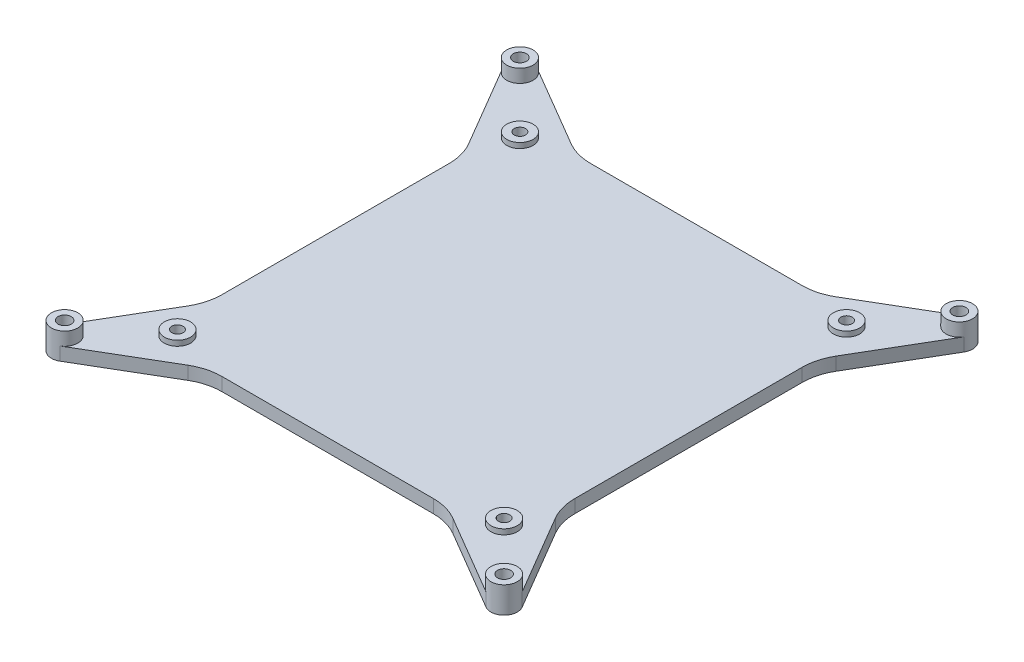
from build123d import *

# Parameters (mm, degrees)
SKETCH1_W                                  = 134
SKETCH1_H                                  = 140
BOSS_EXTRUDE1_DEPTH                        = 5
BOSS_EXTRUDE3_DEPTH                        = 5
SKETCH3_R                                  = 5
BOSS_EXTRUDE4_DEPTH                        = 5
HOLE1_OUTLINE_R                            = 2.5
HOLE1_DEPTH                                = 10
SKETCH6_R                                  = 5
BOSS_EXTRUDE5_DEPTH                        = 2
HOLE2_OUTLINE_R                            = 2.15
HOLE2_DEPTH                                = 7
MIRROR1_AT_THE_SECOND_PLANE_COPY_1_DEPTH   = 5
MIRROR1_AT_THE_SECOND_PLANE_COPY_2_SKETC_R = 5
MIRROR1_AT_THE_SECOND_PLANE_COPY_2_DEPTH   = 5
MIRROR1_AT_THE_SECOND_PLANE_COPY_3_SKETC_R = 2.5
MIRROR1_AT_THE_SECOND_PLANE_COPY_3_DEPTH   = 10
MIRROR1_AT_THE_SECOND_PLANE_COPY_4_SKETC_R = 5
MIRROR1_AT_THE_SECOND_PLANE_COPY_4_DEPTH   = 2
MIRROR1_AT_THE_SECOND_PLANE_COPY_5_SKETC_R = 2.15
MIRROR1_AT_THE_SECOND_PLANE_COPY_5_DEPTH   = 7
CUT_EXTRUDE_THIN1_DEPTH                    = 232.199441913
MIRROR2_AT_THE_SECOND_PLANE_COPY_1_DEPTH   = 232.199441913
FILLET1_R                                  = 20


# Read off the part's stored shape, not the designer's step: Hole1, Hole2
with BuildPart() as part:
    # Sketch1 → Boss-Extrude1 (new body)
    with BuildSketch(Plane(origin=(0, 0, 0), x_dir=(1, 0, 0), z_dir=(0, 1, 0))):
        with Locations((67, 70)):
            Rectangle(SKETCH1_W, SKETCH1_H)
    extrude(amount=BOSS_EXTRUDE1_DEPTH)

    # Sketch2 → Boss-Extrude3 (add)
    with BuildSketch(Plane(origin=(0, 5, 0), x_dir=(1, 0, 0), z_dir=(0, 1, 0))):
        with BuildLine():
            Line((0, 118.595175856), (-24.35045716, 150.329309467))
            ThreePointArc((-24.35045716, 150.329309467), (-23.487991569, 163.487991569), (-10.329309467, 164.35045716))
            Line((-10.329309467, 164.35045716), (21.404824144, 140))
            Line((21.404824144, 140), (0, 140))
            Line((0, 140), (0, 118.595175856))
        make_face()
    boss_extrude3 = extrude(amount=-BOSS_EXTRUDE3_DEPTH)

    # Sketch3 → Boss-Extrude4 (add)
    with BuildSketch(Plane(origin=(0, 5, 0), x_dir=(1, 0, 0), z_dir=(0, 1, 0))):
        with Locations(Location((-16.416923757, 156.416923757, 0), (0, 0, 90))):
            Circle(SKETCH3_R)
    boss_extrude4 = extrude(amount=BOSS_EXTRUDE4_DEPTH)

    # Hole1 outline → Hole1 (cut)
    with BuildSketch(Plane(origin=(0, 0, 0), x_dir=(1, 0, 0), z_dir=(0, 1, 0))):
        with Locations((-16.416923757, 156.416923757)):
            Circle(HOLE1_OUTLINE_R)
    hole1 = extrude(amount=HOLE1_DEPTH, mode=Mode.SUBTRACT)

    # Sketch6 → Boss-Extrude5 (add)
    with BuildSketch(Plane(origin=(0, 5, 0), x_dir=(1, 0, 0), z_dir=(0, 1, 0))):
        with Locations(Location((5, 135, 0), (0, 0, 90))):
            Circle(SKETCH6_R)
    boss_extrude5 = extrude(amount=BOSS_EXTRUDE5_DEPTH)

    # Hole2 outline → Hole2 (cut)
    with BuildSketch(Plane(origin=(0, 0, 0), x_dir=(1, 0, 0), z_dir=(0, 1, 0))):
        with Locations((5, 135)):
            Circle(HOLE2_OUTLINE_R)
    hole2 = extrude(amount=HOLE2_DEPTH, mode=Mode.SUBTRACT)

    # Mirror1: Boss-Extrude3, Boss-Extrude4, Hole1, Boss-Extrude5, Hole2 across plane
    add(boss_extrude3.mirror(Plane.XY.offset(-70)))
    add(boss_extrude4.mirror(Plane.XY.offset(-70)))
    add(hole1.mirror(Plane.XY.offset(-70)), mode=Mode.SUBTRACT)
    add(boss_extrude5.mirror(Plane.XY.offset(-70)))
    add(hole2.mirror(Plane.XY.offset(-70)), mode=Mode.SUBTRACT)

    # Mirror1 at the second plane: Boss-Extrude3, Boss-Extrude4, Hole1, Boss-Extrude5, Hole2 across plane
    add(boss_extrude3.mirror(Plane.ZY.offset(-67)))
    add(boss_extrude4.mirror(Plane.ZY.offset(-67)))
    add(hole1.mirror(Plane.ZY.offset(-67)), mode=Mode.SUBTRACT)
    add(boss_extrude5.mirror(Plane.ZY.offset(-67)))
    add(hole2.mirror(Plane.ZY.offset(-67)), mode=Mode.SUBTRACT)

    # Mirror1 at the second plane copy 1 sketc → Mirror1 at the second plane copy 1 (add)
    with BuildSketch(Plane(origin=(134, 5, -140), x_dir=(-1, 0, 0), z_dir=(0, 1, 0))):
        with BuildLine():
            Line((0, 118.595175856), (-24.35045716, 150.329309467))
            ThreePointArc((-24.35045716, 150.329309467), (-23.487991569, 163.487991569), (-10.329309467, 164.35045716))
            Line((-10.329309467, 164.35045716), (21.404824144, 140))
            Line((21.404824144, 140), (0, 140))
            Line((0, 140), (0, 118.595175856))
        make_face()
    extrude(amount=-MIRROR1_AT_THE_SECOND_PLANE_COPY_1_DEPTH)

    # Mirror1 at the second plane copy 2 sketc → Mirror1 at the second plane copy 2 (add)
    with BuildSketch(Plane(origin=(134, 5, -140), x_dir=(-1, 0, 0), z_dir=(0, 1, 0))):
        with Locations(Location((-16.416923757, 156.416923757, 0), (0, 0, 90))):
            Circle(MIRROR1_AT_THE_SECOND_PLANE_COPY_2_SKETC_R)
    extrude(amount=MIRROR1_AT_THE_SECOND_PLANE_COPY_2_DEPTH)

    # Mirror1 at the second plane copy 3 sketc → Mirror1 at the second plane copy 3 (cut)
    with BuildSketch(Plane(origin=(134, 0, -140), x_dir=(-1, 0, 0), z_dir=(0, 1, 0))):
        with Locations((-16.416923757, 156.416923757)):
            Circle(MIRROR1_AT_THE_SECOND_PLANE_COPY_3_SKETC_R)
    extrude(amount=MIRROR1_AT_THE_SECOND_PLANE_COPY_3_DEPTH, mode=Mode.SUBTRACT)

    # Mirror1 at the second plane copy 4 sketc → Mirror1 at the second plane copy 4 (add)
    with BuildSketch(Plane(origin=(134, 5, -140), x_dir=(-1, 0, 0), z_dir=(0, 1, 0))):
        with Locations(Location((5, 135, 0), (0, 0, 90))):
            Circle(MIRROR1_AT_THE_SECOND_PLANE_COPY_4_SKETC_R)
    extrude(amount=MIRROR1_AT_THE_SECOND_PLANE_COPY_4_DEPTH)

    # Mirror1 at the second plane copy 5 sketc → Mirror1 at the second plane copy 5 (cut)
    with BuildSketch(Plane(origin=(134, 0, -140), x_dir=(-1, 0, 0), z_dir=(0, 1, 0))):
        with Locations((5, 135)):
            Circle(MIRROR1_AT_THE_SECOND_PLANE_COPY_5_SKETC_R)
    extrude(amount=MIRROR1_AT_THE_SECOND_PLANE_COPY_5_DEPTH, mode=Mode.SUBTRACT)

    # Sketch9 → Cut-Extrude-Thin1 (cut, symmetric)
    with BuildSketch(Plane(origin=(0, 5, 0), x_dir=(1, 0, 0), z_dir=(0, 1, 0))):
        with BuildLine():
            Line((0, 118.595175856), (-20.728209423, 153.88456993))
            ThreePointArc((-20.728209423, 153.88456993), (-19.952457663, 159.952457663), (-13.88456993, 160.728209423))
            Line((-13.88456993, 160.728209423), (21.404824144, 140))
            Line((21.404824144, 140), (26.4695318, 148.622571331))
            Line((26.4695318, 148.622571331), (-8.819862274, 169.350780755))
            ThreePointArc((-8.819862274, 169.350780755), (-27.023525475, 167.023525475), (-29.350780755, 148.819862274))
            Line((-29.350780755, 148.819862274), (-8.622571331, 113.5304682))
            Line((-8.622571331, 113.5304682), (0, 118.595175856))
        make_face()
    cut_extrude_thin1 = extrude(amount=CUT_EXTRUDE_THIN1_DEPTH, both=True, mode=Mode.SUBTRACT)

    # Mirror2: Cut-Extrude-Thin1 across plane
    add(cut_extrude_thin1.mirror(Plane.ZY.offset(-67)), mode=Mode.SUBTRACT)

    # Mirror2 at the second plane: Cut-Extrude-Thin1 across plane
    add(cut_extrude_thin1.mirror(Plane.XY.offset(-70)), mode=Mode.SUBTRACT)

    # Mirror2 at the second plane copy 1 sketc → Mirror2 at the second plane copy 1 (cut, symmetric)
    with BuildSketch(Plane(origin=(134, 5, -140), x_dir=(-1, 0, 0), z_dir=(0, 1, 0))):
        with BuildLine():
            Line((0, 118.595175856), (-20.728209423, 153.88456993))
            ThreePointArc((-20.728209423, 153.88456993), (-19.952457663, 159.952457663), (-13.88456993, 160.728209423))
            Line((-13.88456993, 160.728209423), (21.404824144, 140))
            Line((21.404824144, 140), (26.4695318, 148.622571331))
            Line((26.4695318, 148.622571331), (-8.819862274, 169.350780755))
            ThreePointArc((-8.819862274, 169.350780755), (-27.023525475, 167.023525475), (-29.350780755, 148.819862274))
            Line((-29.350780755, 148.819862274), (-8.622571331, 113.5304682))
            Line((-8.622571331, 113.5304682), (0, 118.595175856))
        make_face()
    extrude(amount=MIRROR2_AT_THE_SECOND_PLANE_COPY_1_DEPTH, both=True, mode=Mode.SUBTRACT)

    # Fillet1
    fillet1_edges = [part.edges().sort_by_distance(p)[0] for p in [
        (0, 2.5, -118.595175856),
        (21.404824144, 2.5, -140),
        (112.595175856, 2.5, -140),
        (134, 2.5, -118.595175856),
        (21.404824144, 2.5, 0),
        (0, 2.5, -21.404824144),
        (134, 2.5, -21.404824144),
        (112.595175856, 2.5, 0),
    ]]
    fillet(fillet1_edges, radius=FILLET1_R)


solid = part.part
